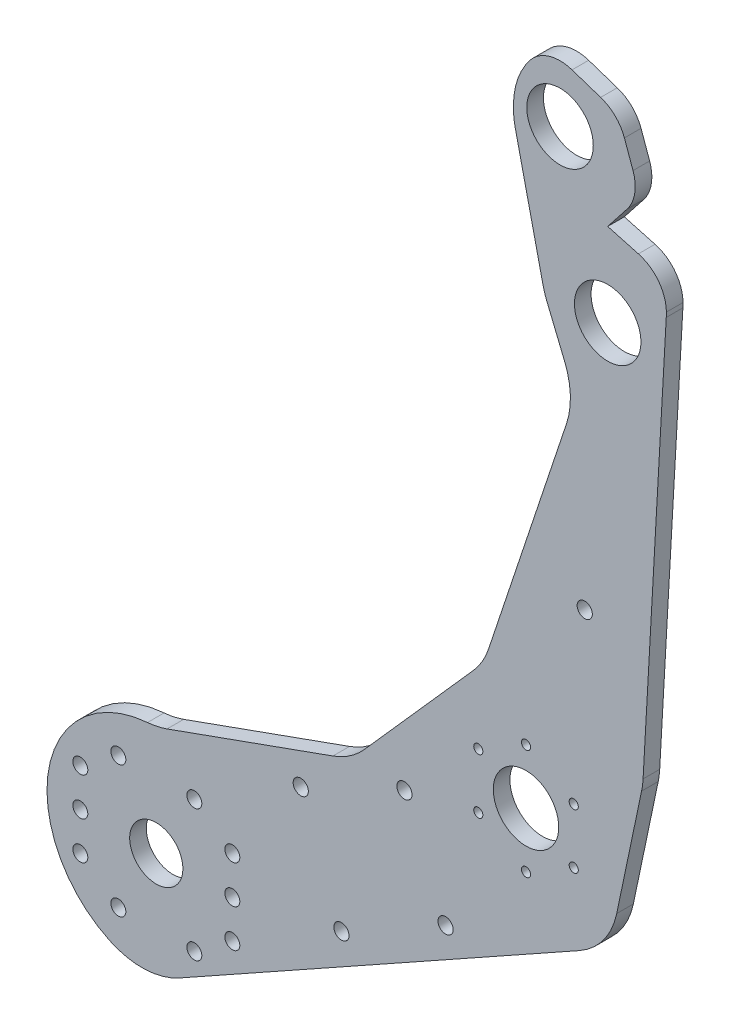
from build123d import *

# Parameters (mm, degrees)
SKETCH1_R           = 8.89
SKETCH1_R_2         = 10.9347
SKETCH1_R_3         = 11.1125
SKETCH1_R_4         = 1.524
SKETCH1_R_5         = 2.5
SKETCH1_R_6         = 2.54
BOSS_EXTRUDE1_DEPTH = 5.55625
FILLET1_R           = 25.4
FILLET3_R           = 12.7
FILLET4_R           = 12.7


with BuildPart() as part:
    # Sketch1 → Boss-Extrude1 (new body)
    with BuildSketch(Plane.XY):
        with BuildLine():
            Line((199.79602437, 71.078107547), (188.964925061, 57.285610842))
            Line((188.964925061, 57.285610842), (206.456809173, 52.506453094))
            Line((206.456809173, 52.506453094), (208.830818929, 45.887219752))
            Line((208.830818929, 45.887219752), (200.684125291, -98.616772294))
            Line((200.684125291, -98.616772294), (189.611167808, -151.385643895))
            Line((189.611167808, -151.385643895), (38.107034572, -236.120024372))
            ThreePointArc((38.107034572, -236.120024372), (1.581834572, -199.594824372), (38.107034572, -163.069624372))
            Line((38.107034572, -163.069624372), (103.261818833, -139.701647224))
            Line((103.261818833, -139.701647224), (147.550432491, -89.7457244))
            Line((147.550432491, -89.7457244), (171.836242771, -16.814689905))
            Line((171.836242771, -16.814689905), (178.189444477, 2.26417003))
            Line((178.189444477, 2.26417003), (167.830043749, 27.447208055))
            Line((167.830043749, 27.447208055), (157.470643022, 73.010133983))
            Line((157.470643022, 73.010133983), (157.470643022, 93.390021886))
            Line((157.470643022, 93.390021886), (170.600142232, 98.791028052))
            Line((170.600142232, 98.791028052), (192.468434241, 91.508954042))
            Line((192.468434241, 91.508954042), (199.79602437, 71.078107547))
        make_face()
        with Locations((38.107034572, -199.594824372)):
            Circle(SKETCH1_R, mode=Mode.SUBTRACT)
        with Locations((161.671727665, -124.770570211)):
            Circle(SKETCH1_R_2, mode=Mode.SUBTRACT)
        with Locations((188.964925061, 29.396113336)):
            Circle(SKETCH1_R_3, mode=Mode.SUBTRACT)
        with Locations((173.035965272, 78.237579188)):
            Circle(SKETCH1_R_3, mode=Mode.SUBTRACT)
        with Locations((161.671727665, -106.355570211)):
            Circle(SKETCH1_R_4, mode=Mode.SUBTRACT)
        with Locations((12.721199582, -186.891028869)):
            Circle(SKETCH1_R_5, mode=Mode.SUBTRACT)
        with Locations((177.619585475, -115.563070211)):
            Circle(SKETCH1_R_4, mode=Mode.SUBTRACT)
        with Locations((177.619585475, -133.978070211)):
            Circle(SKETCH1_R_4, mode=Mode.SUBTRACT)
        with Locations((161.671727665, -143.185570211)):
            Circle(SKETCH1_R_4, mode=Mode.SUBTRACT)
        with Locations((145.723869854, -133.978070211)):
            Circle(SKETCH1_R_4, mode=Mode.SUBTRACT)
        with Locations((145.723869854, -115.563070211)):
            Circle(SKETCH1_R_4, mode=Mode.SUBTRACT)
        with Locations((12.721199582, -199.591028869)):
            Circle(SKETCH1_R_5, mode=Mode.SUBTRACT)
        with Locations((12.721199582, -212.291028869)):
            Circle(SKETCH1_R_5, mode=Mode.SUBTRACT)
        with Locations((25.421199582, -221.588074125)):
            Circle(SKETCH1_R_5, mode=Mode.SUBTRACT)
        with Locations((25.421199582, -177.593983613)):
            Circle(SKETCH1_R_5, mode=Mode.SUBTRACT)
        with Locations((50.821199582, -177.593983613)):
            Circle(SKETCH1_R_5, mode=Mode.SUBTRACT)
        with Locations((63.521199582, -186.891028869)):
            Circle(SKETCH1_R_5, mode=Mode.SUBTRACT)
        with Locations((63.521199582, -199.591028869)):
            Circle(SKETCH1_R_5, mode=Mode.SUBTRACT)
        with Locations((63.521199582, -212.291028869)):
            Circle(SKETCH1_R_5, mode=Mode.SUBTRACT)
        with Locations((50.821199582, -221.588074125)):
            Circle(SKETCH1_R_5, mode=Mode.SUBTRACT)
        with Locations((181.29246285, -57.510690342)):
            Circle(SKETCH1_R_6, mode=Mode.SUBTRACT)
        with Locations((99.96903305, -191.23088449)):
            Circle(SKETCH1_R_6, mode=Mode.SUBTRACT)
        with Locations((134.782371312, -172.083548446)):
            Circle(SKETCH1_R_6, mode=Mode.SUBTRACT)
        with Locations((121.031102699, -139.896498857)):
            Circle(SKETCH1_R_6, mode=Mode.SUBTRACT)
        with Locations((86.391831128, -156.243479537)):
            Circle(SKETCH1_R_6, mode=Mode.SUBTRACT)
    extrude(amount=BOSS_EXTRUDE1_DEPTH)

    # Fillet1
    # the kernel refuses this fillet: 25.4 mm, written as the material it adds along each edge
    with BuildSketch(Plane(origin=(178.189444477, 2.26417003, 0), x_dir=(-0.38043310119112633, 0.9248084426074961, 0), z_dir=(0, 0, 1))) as fillet1_piece_1:
        with BuildLine():
            CenterArc((FILLET1_R * 0.371679258358, FILLET1_R), FILLET1_R, 229.221887669, 40.778112331)
            Line((-FILLET1_R * 0.281452116845, FILLET1_R * 0.242755385146), (0, 0))
            Line((0, 0), (FILLET1_R * 0.371679258358, 0))
        make_face()
    extrude(amount=5.55625)
    with BuildSketch(Plane(origin=(147.550432491, -89.7457244, 0), x_dir=(0.3159404927300864, 0.9487790074898739, 0), z_dir=(0, 0, 1))) as fillet1_piece_2:
        with BuildLine():
            CenterArc((FILLET1_R * 0.204735054156, FILLET1_R), FILLET1_R, 246.858885181, 23.141114819)
            Line((-FILLET1_R * 0.188262015137, FILLET1_R * 0.0804602762649), (0, 0))
            Line((0, 0), (FILLET1_R * 0.204735054156, 0))
        make_face()
    extrude(amount=5.55625)
    with BuildSketch(Plane(origin=(103.261818833, -139.701647224, 0), x_dir=(0.6633872027522849, 0.7482762987189282, 0), z_dir=(0, 0, 1))) as fillet1_piece_3:
        with BuildLine():
            CenterArc((FILLET1_R * 0.255926298649, FILLET1_R), FILLET1_R, 241.289253159, 28.710746841)
            Line((-FILLET1_R * 0.224461714683, FILLET1_R * 0.122943926167), (0, 0))
            Line((0, 0), (FILLET1_R * 0.255926298649, 0))
        make_face()
    extrude(amount=5.55625)
    with BuildSketch(Plane(origin=(38.107034572, -163.069624372, 0), x_dir=(-0.999191470019892, -0.040204554959449905, 0), z_dir=(0, 0, 1))) as fillet1_piece_4:
        with BuildLine():
            CenterArc((3.958154518, -25.379463339), FILLET1_R, 92.304172347, 15.122193833)
            Line((-3.648634427, -1.145256895), (0, 0))
            ThreePointArc((0, 0), (1.468479411, -0.029531719), (2.936958822, 0))
        make_face()
    extrude(amount=5.55625)
    # the kernel refuses this fillet: 25.4 mm, written as the material it takes off along each edge
    with BuildSketch(Plane(origin=(157.470643022, 93.390021886, -42.096203676), x_dir=(0, -1, 0), z_dir=(0, 0, 1))) as fillet1_2_piece_1:
        with BuildLine():
            CenterArc((16.83848147, 25.4), FILLET1_R, 208.887448124, 61.112551876)
            Line((-5.401006167, 13.12949921), (0, 0))
            Line((0, 0), (16.83848147, 0))
        make_face()
    extrude(amount=89.748657352, mode=Mode.SUBTRACT)
    with BuildSketch(Plane(origin=(157.470643022, 73.010133983, -7.12787144), x_dir=(0.2217063764510564, -0.9751134716744213, 0), z_dir=(0, 0, 1))) as fillet1_2_piece_2:
        with BuildLine():
            CenterArc((FILLET1_R * 0.11224994393, FILLET1_R), FILLET1_R, 257.190723516, 12.809276484)
            Line((-FILLET1_R * 0.109456432521, FILLET1_R * 0.0248865283256), (0, 0))
            Line((0, 0), (FILLET1_R * 0.11224994393, 0))
        make_face()
    extrude(amount=19.811992879, mode=Mode.SUBTRACT)
    with BuildSketch(Plane(origin=(167.830043749, 27.447208055, -5.305032246), x_dir=(0.38043310119112356, -0.9248084426074973, 0), z_dir=(0, 0, 1))) as fillet1_2_piece_3:
        with BuildLine():
            CenterArc((FILLET1_R * 0.0835438149047, FILLET1_R), FILLET1_R, 260.448763965, 9.551236035)
            Line((-FILLET1_R * 0.0823856984158, FILLET1_R * 0.0138623845481), (0, 0))
            Line((0, 0), (FILLET1_R * 0.0835438149047, 0))
        make_face()
    extrude(amount=16.166314493, mode=Mode.SUBTRACT)
    with BuildSketch(Plane(origin=(38.107034572, -236.120024372, -39.792317969), x_dir=(-0.975973408380196, 0.21788966504803134, 0), z_dir=(0, 0, 1))) as fillet1_2_piece_4:
        with BuildLine():
            CenterArc((10.382529695, -24.789724573), FILLET1_R, 77.414886959, 54.38796922)
            Line((-6.548338937, -5.855478157), (0, 0))
            ThreePointArc((0, 0), (7.958463594, 0.877576064), (15.916927188, 0))
        make_face()
    extrude(amount=85.140885938, mode=Mode.SUBTRACT)
    with BuildSketch(Plane(origin=(189.611167808, -151.385643895, -28.892669195), x_dir=(-0.8727709569033328, -0.4881299589105759, 0), z_dir=(0, 0, 1))) as fillet1_2_piece_5:
        with BuildLine():
            CenterArc((FILLET1_R * 0.455002664481, -FILLET1_R), FILLET1_R, 90, 48.931323179)
            Line((-FILLET1_R * 0.298919997384, -FILLET1_R * 0.343036819962), (0, 0))
            Line((0, 0), (FILLET1_R * 0.455002664481, 0))
        make_face()
    extrude(amount=63.341588389, mode=Mode.SUBTRACT)
    with BuildSketch(Plane(origin=(200.684125291, -98.616772294, -4.788068762), x_dir=(0.056287565067425785, 0.9984145982600516, 0), z_dir=(0, 0, 1))) as fillet1_2_piece_6:
        with BuildLine():
            CenterArc((FILLET1_R * 0.0754026576756, FILLET1_R), FILLET1_R, 261.375811644, 8.624188356)
            Line((-FILLET1_R * 0.0745500922014, FILLET1_R * 0.0113068358665), (0, 0))
            Line((0, 0), (FILLET1_R * 0.0754026576756, 0))
        make_face()
    extrude(amount=15.132387525, mode=Mode.SUBTRACT)
    with BuildSketch(Plane(origin=(208.830818929, 45.887219752, -12.894572268), x_dir=(-0.3375970122965893, 0.9412907400417878, 0), z_dir=(0, 0, 1))) as fillet1_2_piece_7:
        with BuildLine():
            CenterArc((FILLET1_R * 0.203064130199, FILLET1_R), FILLET1_R, 247.042716146, 22.957283854)
            Line((-FILLET1_R * 0.186980618985, FILLET1_R * 0.0792040977315), (0, 0))
            Line((0, 0), (FILLET1_R * 0.203064130199, 0))
        make_face()
    extrude(amount=31.345394535, mode=Mode.SUBTRACT)

    # Fillet3
    fillet3_edges = [part.edges().sort_by_distance(p)[0] for p in [
        (170.600142232, 98.791028052, 2.778125),
        (192.468434241, 91.508954042, 2.778125),
    ]]
    fillet(fillet3_edges, radius=FILLET3_R)

    # Fillet4
    fillet4_edges = [part.edges().sort_by_distance(p)[0] for p in [
        (206.456809173, 52.506453094, 2.778125),
        (199.79602437, 71.078107547, 2.778125),
    ]]
    fillet(fillet4_edges, radius=FILLET4_R)


solid = part.part
